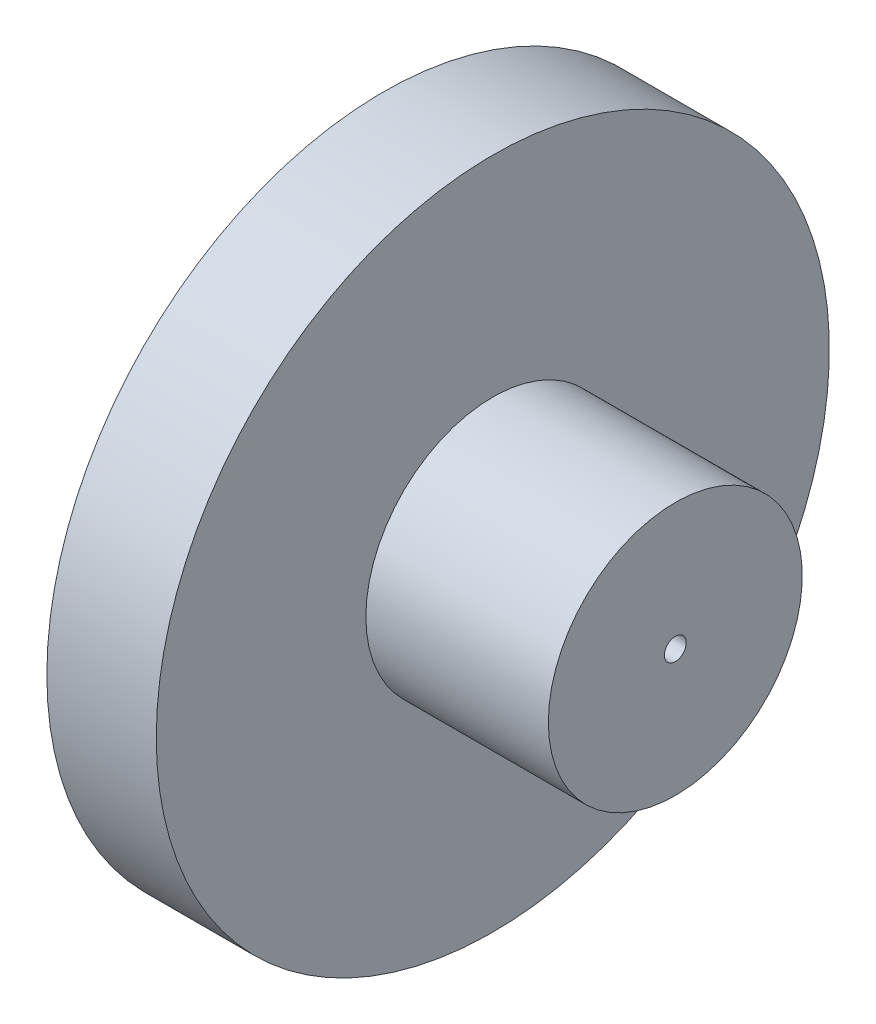
from build123d import *


with BuildPart() as part:
    # Sketch1 → Revolve1 (revolve)
    with BuildSketch(Plane.XY):
        Polygon((-103.592290751, 5), (-103.592290751, 32.810148198), (-25, 32.810148198), (-25, 153.810148198), (25, 153.810148198), (25, 58.022786047), (108.407709249, 58.022786047), (108.407709249, 5), align=None)
    revolve(axis=Axis((-37.411989194, 0, 0), (1, 0, 0)))


solid = part.part
